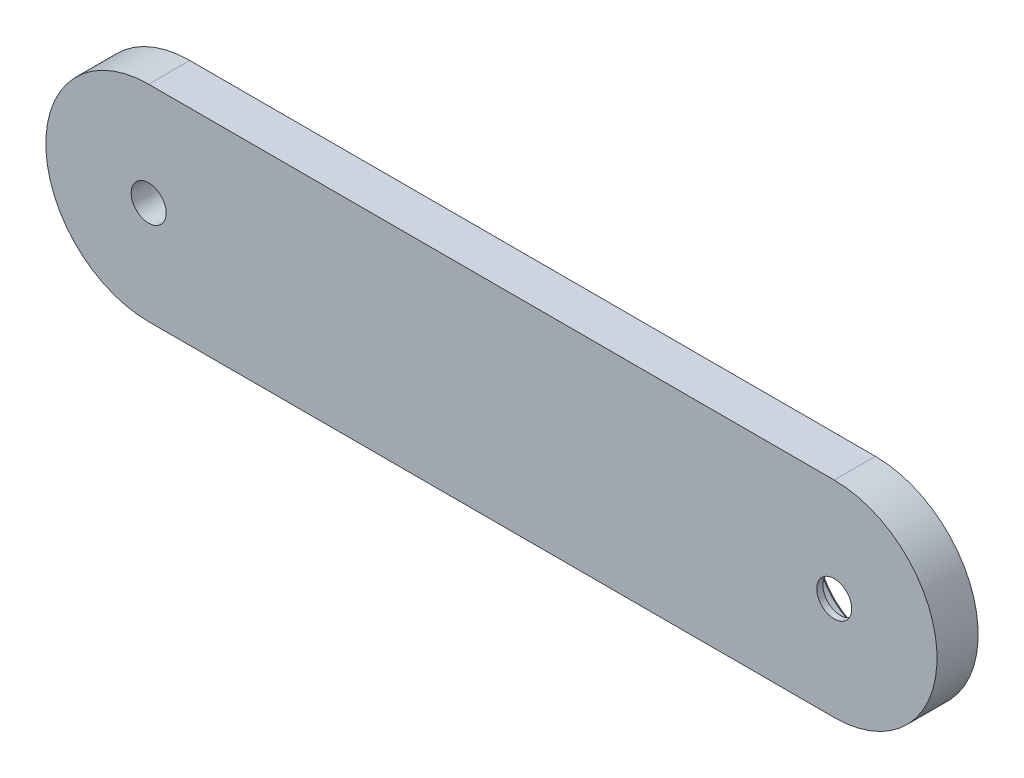
from build123d import *

# Parameters (mm, degrees)
BOSS_EXTRUDE1_DEPTH = 6
SKETCH9_R           = 7.975
CUT_EXTRUDE5_DEPTH  = 5.1
SKETCH10_R          = 2.55
CUT_EXTRUDE6_DEPTH  = 67.90298947
SKETCH11_R          = 2.55
CUT_EXTRUDE7_DEPTH  = 67.977608199
CHAMFER1_SIZE       = 0.5


with BuildPart() as part:
    # Sketch4 → Boss-Extrude1 (new body)
    with BuildSketch(Plane.XY):
        with BuildLine():
            Line((-50, 15), (50, 15))
            ThreePointArc((50, 15), (65, 0), (50, -15))
            Line((50, -15), (-50, -15))
            ThreePointArc((-50, -15), (-65, 0), (-50, 15))
        make_face()
    extrude(amount=BOSS_EXTRUDE1_DEPTH)

    # Sketch9 → Cut-Extrude5 (cut)
    with BuildSketch(Plane(origin=(0, 0, 0), x_dir=(-1, 0, 0), z_dir=(0, 0, -1))):
        with Locations((-50, 0)):
            Circle(SKETCH9_R)
    extrude(amount=-CUT_EXTRUDE5_DEPTH, mode=Mode.SUBTRACT)

    # Sketch10 → Cut-Extrude6 (cut, through all)
    with BuildSketch(Plane(origin=(0, 0, 5.1), x_dir=(-1, 0, 0), z_dir=(0, 0, -1))):
        with Locations((-50, 0)):
            Circle(SKETCH10_R)
    extrude(amount=-CUT_EXTRUDE6_DEPTH, mode=Mode.SUBTRACT)

    # Sketch11 → Cut-Extrude7 (cut, through all)
    with BuildSketch(Plane(origin=(0, 0, 0), x_dir=(-1, 0, 0), z_dir=(0, 0, -1))):
        with Locations((50, 0)):
            Circle(SKETCH11_R)
    extrude(amount=-CUT_EXTRUDE7_DEPTH, mode=Mode.SUBTRACT)

    # Chamfer1
    chamfer1_edges = [part.edges().sort_by_distance(p)[0] for p in [
        (57.975, 0, 0),
    ]]
    chamfer(chamfer1_edges, length=CHAMFER1_SIZE)


solid = part.part
